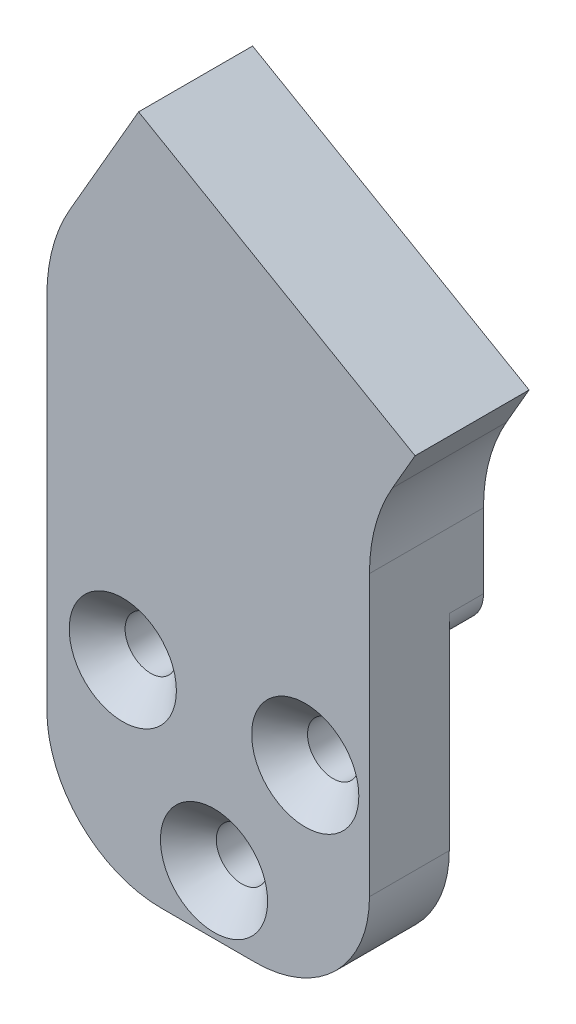
from build123d import *

# Parameters (mm, degrees)
BOSS_EXTRUDE1_DEPTH                                 = 9
BOSS_EXTRUDE1_DEPTH_BACK                            = 1
CUT_EXTRUDE1_DEPTH                                  = 3
CSK_FOR_M4_COUNTERSUNK_FLAT_HEAD_SCREW2_D           = 4.5
CSK_FOR_M4_COUNTERSUNK_FLAT_HEAD_SCREW2_CSINK_D     = 9.4
CSK_FOR_M4_COUNTERSUNK_FLAT_HEAD_SCREW2_CSINK_ANGLE = 90
FILLET1_R                                           = 15
FILLET2_R                                           = 10
FILLET3_R                                           = 3


with BuildPart() as part:
    # Sketch1 → Boss-Extrude1 (new, two sides: drawn at the far end of the back side and taken through both)
    with BuildSketch(Plane.XY.offset(-BOSS_EXTRUDE1_DEPTH_BACK)):
        Polygon((-14.65789802, 119.616999761), (13.633055873, 119.616999761), (13.633055873, 139.616999761), (13.633055873, 158.176865611), (17.633055873, 165.105068841), (-6.615655433, 179.105068841), (-10.615655433, 172.176865611), (-14.65789802, 165.175496074), (-14.65789802, 158.176865611), (-14.65789802, 139.616999761), align=None)
    extrude(amount=BOSS_EXTRUDE1_DEPTH + BOSS_EXTRUDE1_DEPTH_BACK)

    # Sketch3 → Cut-Extrude1 (cut)
    with BuildSketch(Plane(origin=(0, 0, -1), x_dir=(-1, 0, 0), z_dir=(0, 0, -1))):
        with BuildLine():
            Line((-15, 144.248115566), (-15, 114.785930714))
            Line((-15, 114.785930714), (15, 114.785930714))
            Line((15, 114.785930714), (15, 144.248115566))
            ThreePointArc((15, 144.248115566), (0, 145), (-15, 144.248115566))
        make_face()
    extrude(amount=-CUT_EXTRUDE1_DEPTH, mode=Mode.SUBTRACT)

    # CSK for M4 Countersunk Flat Head Screw2 (through all)
    with Locations(Plane.XY.offset(9)):
        with Locations((0, 0), (8, 136.785930714), (-8, 136.785930714), (0, 124.785930714)):
            CounterSinkHole(CSK_FOR_M4_COUNTERSUNK_FLAT_HEAD_SCREW2_D / 2, CSK_FOR_M4_COUNTERSUNK_FLAT_HEAD_SCREW2_CSINK_D / 2, counter_sink_angle=CSK_FOR_M4_COUNTERSUNK_FLAT_HEAD_SCREW2_CSINK_ANGLE)

    # Fillet1
    fillet1_edges = [part.edges().sort_by_distance(p)[0] for p in [
        (13.633055873, 158.176865611, 4),
        (-14.65789802, 165.175496074, 4),
    ]]
    fillet(fillet1_edges, radius=FILLET1_R)

    # Fillet2
    fillet2_edges = [part.edges().sort_by_distance(p)[0] for p in [
        (-14.65789802, 119.616999761, 5.5),
        (13.633055873, 119.616999761, 5.5),
    ]]
    fillet(fillet2_edges, radius=FILLET2_R)

    # Fillet3
    fillet3_edges = [part.edges().sort_by_distance(p)[0] for p in [
        (13.633055873, 144.379181239, 0.5),
        (-14.65789802, 144.282102161, 0.5),
    ]]
    fillet(fillet3_edges, radius=FILLET3_R)


solid = part.part
